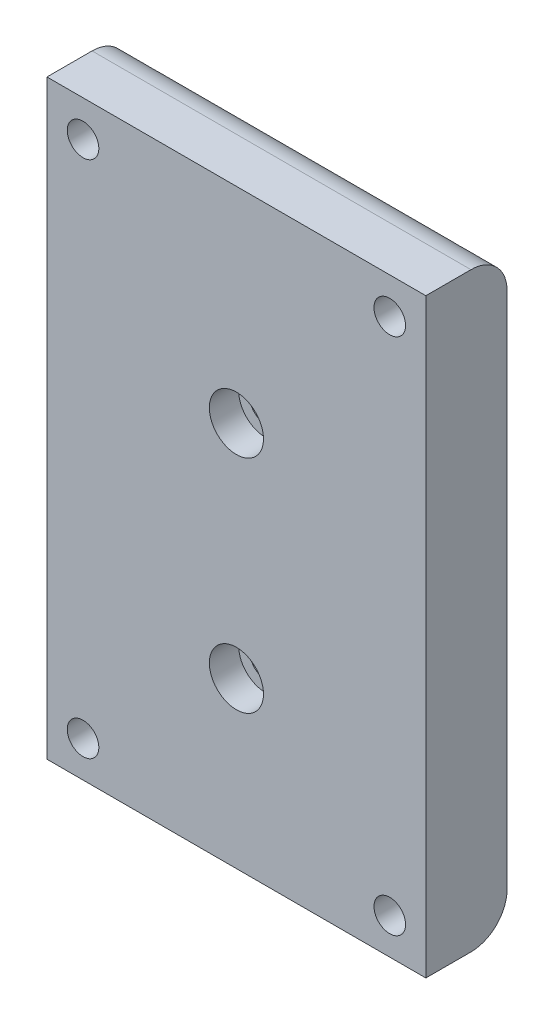
from build123d import *

# Parameters (mm, degrees)
SKETCH1_W           = 42
SKETCH1_H           = 65.5
BOSS_EXTRUDE1_DEPTH = 9
CUT_EXTRUDE2_DEPTH  = 4.5
SKETCH3_R           = 1.75
CUT_EXTRUDE5_DEPTH  = 78.939078773
SKETCH5_R           = 3
CUT_EXTRUDE6_DEPTH  = 3.25
FILLET1_R           = 4
SKETCH6_R           = 1.75
CUT_EXTRUDE7_DEPTH  = 79.327836687
SKETCH7_R           = 3
CUT_EXTRUDE8_DEPTH  = 3


with BuildPart() as part:
    # Sketch1 → Boss-Extrude1 (new body)
    with BuildSketch(Plane.XY):
        with Locations((21, 32.75)):
            Rectangle(SKETCH1_W, SKETCH1_H)
    extrude(amount=BOSS_EXTRUDE1_DEPTH)

    # Sketch2 → Cut-Extrude2 (cut)
    with BuildSketch(Plane(origin=(0, 0, 0), x_dir=(-1, 0, 0), z_dir=(0, 0, -1))):
        with BuildLine():
            Line((-25.5, 18.25), (-25.5, 32.084635496))
            ThreePointArc((-25.5, 32.084635496), (-25.998538124, 35.202683318), (-27.444444444, 38.009837998))
            ThreePointArc((-27.444444444, 38.009837998), (-21, 50.75), (-14.555555556, 38.009837998))
            ThreePointArc((-14.555555556, 38.009837998), (-16.001461876, 35.202683318), (-16.5, 32.084635496))
            Line((-16.5, 32.084635496), (-16.5, 18.25))
            ThreePointArc((-16.5, 18.25), (-21, 13.75), (-25.5, 18.25))
        make_face()
    extrude(amount=-CUT_EXTRUDE2_DEPTH, mode=Mode.SUBTRACT)

    # Sketch3 → Cut-Extrude5 (cut, through all)
    with BuildSketch(Plane(origin=(0, 0, 4.5), x_dir=(-1, 0, 0), z_dir=(0, 0, -1))):
        with Locations((-21, 18.25)):
            Circle(SKETCH3_R)
        with Locations((-21, 42.75)):
            Circle(SKETCH3_R)
    extrude(amount=-CUT_EXTRUDE5_DEPTH, mode=Mode.SUBTRACT)

    # Sketch5 → Cut-Extrude6 (cut)
    with BuildSketch(Plane.XY.offset(9)):
        with Locations((21, 18.25)):
            Circle(SKETCH5_R)
        with Locations((21, 42.75)):
            Circle(SKETCH5_R)
    extrude(amount=-CUT_EXTRUDE6_DEPTH, mode=Mode.SUBTRACT)

    # Fillet1
    fillet1_edges = [part.edges().sort_by_distance(p)[0] for p in [
        (21, 0, 0),
        (21, 65.5, 0),
    ]]
    fillet(fillet1_edges, radius=FILLET1_R)

    # Sketch6 → Cut-Extrude7 (cut, through all)
    with BuildSketch(Plane(origin=(0, 0, 0), x_dir=(-1, 0, 0), z_dir=(0, 0, -1))):
        with Locations((-38, 61.5)):
            Circle(SKETCH6_R)
        with Locations((-4, 61.5)):
            Circle(SKETCH6_R)
        with Locations((-4, 4)):
            Circle(SKETCH6_R)
        with Locations((-38, 4)):
            Circle(SKETCH6_R)
    extrude(amount=-CUT_EXTRUDE7_DEPTH, mode=Mode.SUBTRACT)

    # Sketch7 → Cut-Extrude8 (cut)
    with BuildSketch(Plane(origin=(0, 0, 0), x_dir=(-1, 0, 0), z_dir=(0, 0, -1))):
        with Locations((-38, 61.5)):
            Circle(SKETCH7_R)
        with Locations((-4, 61.5)):
            Circle(SKETCH7_R)
        with Locations((-4, 4)):
            Circle(SKETCH7_R)
        with Locations((-38, 4)):
            Circle(SKETCH7_R)
    extrude(amount=-CUT_EXTRUDE8_DEPTH, mode=Mode.SUBTRACT)


solid = part.part
